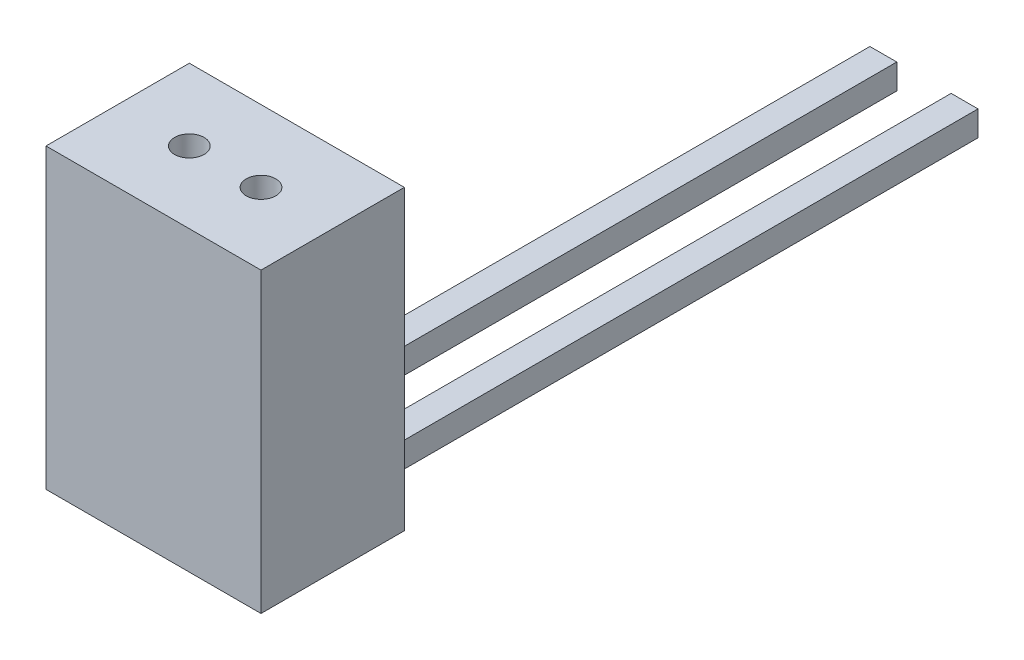
from build123d import *

# Parameters (mm, degrees)
SKETCH2_W             = 3
SKETCH2_H             = 2.8
BOSS_EXTRUDE1_DEPTH   = 70
BOSS_EXTRUDE1_2_DEPTH = 70
SKETCH3_W             = 24
SKETCH3_H             = 33.2
BOSS_EXTRUDE2_DEPTH   = 16
SKETCH4_R             = 1.65
CUT_EXTRUDE1_DEPTH    = 82.106349936
CUT_EXTRUDE2_START    = 3
CUT_EXTRUDE2_DEPTH    = 2.8


with BuildPart() as part:
    # Sketch2 → Boss-Extrude1 (new body)
    with BuildSketch(Plane.XY):
        with Locations((7.466666667, 1.4)):
            Rectangle(SKETCH2_W, SKETCH2_H)
    extrude(amount=-BOSS_EXTRUDE1_DEPTH)



with BuildPart() as body_2:
    # Sketch2 → Boss-Extrude1 2 (new body)
    with BuildSketch(Plane.XY):
        with Locations((16.533333333, 1.4)):
            Rectangle(SKETCH2_W, SKETCH2_H)
    extrude(amount=-BOSS_EXTRUDE1_2_DEPTH)


with BuildPart() as part_1:
    add(part.part)

    add(body_2.part)  # Boss-Extrude2 merges body 2
    # Sketch3 → Boss-Extrude2 (add)
    with BuildSketch(Plane.XY):
        with Locations((12, 16.6)):
            Rectangle(SKETCH3_W, SKETCH3_H)
    extrude(amount=BOSS_EXTRUDE2_DEPTH)

    # Sketch4 → Cut-Extrude1 (cut, through all)
    with BuildSketch(Plane(origin=(0, 0, 0), x_dir=(1, 0, 0), z_dir=(0, 1, 0))):
        with Locations((8, -8)):
            Circle(SKETCH4_R)
        with Locations((16, -8)):
            Circle(SKETCH4_R)
    extrude(amount=CUT_EXTRUDE1_DEPTH, mode=Mode.SUBTRACT)

    # Sketch5 → Cut-Extrude2 (cut)
    with BuildSketch(Plane(origin=(0, 0, 0), x_dir=(1, 0, 0), z_dir=(0, 1, 0)).offset(CUT_EXTRUDE2_START)):
        Polygon((11.290896534, -8), (9.645448267, -5.15), (6.354551733, -5.15), (4.709103466, -8), (6.354551733, -10.85), (9.645448267, -10.85), align=None)
        Polygon((19.290896534, -8), (17.645448267, -5.15), (14.354551733, -5.15), (12.709103466, -8), (14.354551733, -10.85), (17.645448267, -10.85), align=None)
    extrude(amount=CUT_EXTRUDE2_DEPTH, mode=Mode.SUBTRACT)


solid = part_1.part
